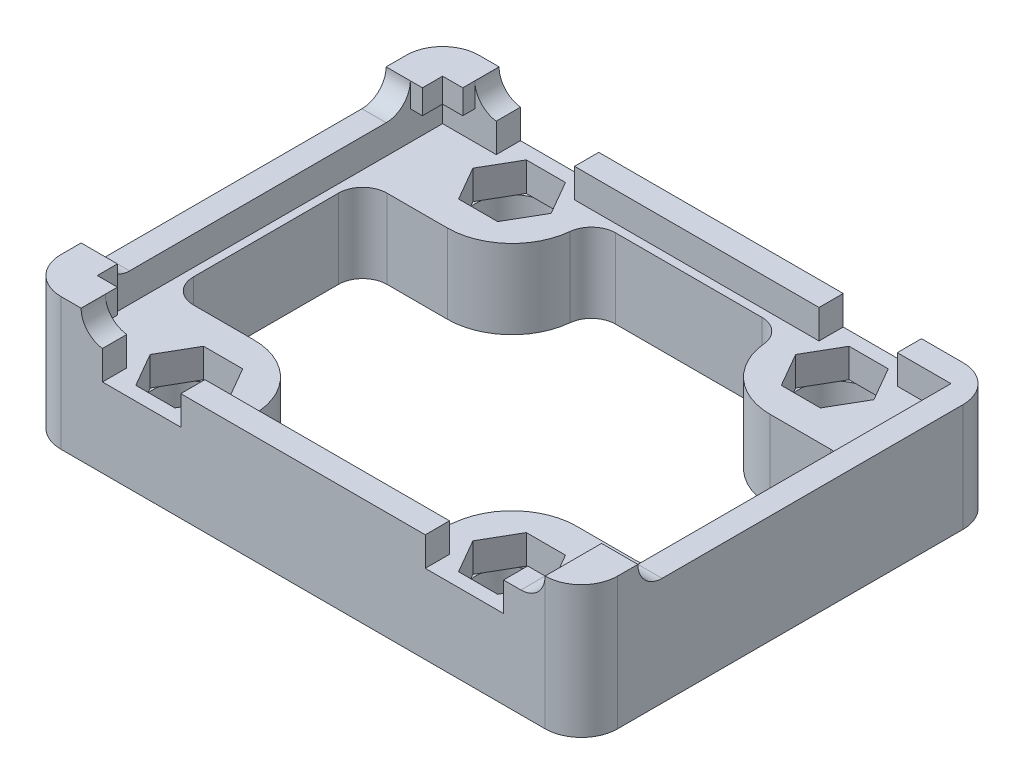
from build123d import *

# Parameters (mm, degrees)
SKETCH1_W           = 34.5
SKETCH1_H           = 25.9
SKETCH1_R           = 1.55
BOSS_EXTRUDE1_DEPTH = 1.5
SKETCH3_W           = 34.5
SKETCH3_H           = 25.9
SKETCH3_R           = 2.25
BOSS_EXTRUDE3_DEPTH = 1.6
SKETCH5_W           = 34.5
SKETCH5_H           = 25.9
BOSS_EXTRUDE4_DEPTH = 1.8
SKETCH6_W           = 15.150257738
SKETCH6_H           = 1.5
BOSS_EXTRUDE5_DEPTH = 1.8
BOSS_EXTRUDE6_DEPTH = 1.5
CUT_EXTRUDE1_REACH  = 24.165
FILLET1_R           = 1.5
FILLET2_R           = 2.25


with BuildPart() as part:
    # Sketch1 → Boss-Extrude1 (new body)
    with BuildSketch(Plane(origin=(0, 0, 0), x_dir=(1, 0, 0), z_dir=(0, 1, 0))):
        Rectangle(SKETCH1_W, SKETCH1_H)
        with Locations(Location((-10, 10, 0), (0, 0, 270))):
            Circle(SKETCH1_R, mode=Mode.SUBTRACT)
        with Locations(Location((10, 10, 0), (0, 0, 270))):
            Circle(SKETCH1_R, mode=Mode.SUBTRACT)
        with Locations(Location((10, -10, 0), (0, 0, 270))):
            Circle(SKETCH1_R, mode=Mode.SUBTRACT)
        with Locations(Location((-10, -10, 0), (0, 0, 270))):
            Circle(SKETCH1_R, mode=Mode.SUBTRACT)
    extrude(amount=BOSS_EXTRUDE1_DEPTH)

    # Sketch3 → Boss-Extrude3 (add)
    with BuildSketch(Plane(origin=(0, 1.5, 0), x_dir=(1, 0, 0), z_dir=(0, 1, 0))):
        Rectangle(SKETCH3_W, SKETCH3_H)
        with Locations(Location((-10, 10, 0), (0, 0, 270))):
            Circle(SKETCH3_R, mode=Mode.SUBTRACT)
        with Locations(Location((10, 10, 0), (0, 0, 270))):
            Circle(SKETCH3_R, mode=Mode.SUBTRACT)
        with Locations(Location((10, -10, 0), (0, 0, 270))):
            Circle(SKETCH3_R, mode=Mode.SUBTRACT)
        with Locations(Location((-10, -10, 0), (0, 0, 270))):
            Circle(SKETCH3_R, mode=Mode.SUBTRACT)
    extrude(amount=BOSS_EXTRUDE3_DEPTH)

    # Sketch5 → Boss-Extrude4 (add)
    with BuildSketch(Plane(origin=(0, 3.1, 0), x_dir=(1, 0, 0), z_dir=(0, 1, 0))):
        Rectangle(SKETCH5_W, SKETCH5_H)
        with BuildLine():
            Line((-6, -10.95), (-6, -10))
            ThreePointArc((-6, -10), (-7.171572875, -7.171572875), (-10, -6))
            Line((-10, -6), (-15.25, -6))
            Line((-15.25, -6), (-15.25, 6))
            Line((-15.25, 6), (-10, 6))
            ThreePointArc((-10, 6), (-7.171572875, 7.171572875), (-6, 10))
            Line((-6, 10), (-6, 10.95))
            Line((-6, 10.95), (6, 10.95))
            Line((6, 10.95), (6, 10))
            ThreePointArc((6, 10), (7.171572875, 7.171572875), (10, 6))
            Line((10, 6), (15.25, 6))
            Line((15.25, 6), (15.25, -6))
            Line((15.25, -6), (10, -6))
            ThreePointArc((10, -6), (7.171572875, -7.171572875), (6, -10))
            Line((6, -10), (6, -10.95))
            Line((6, -10.95), (-6, -10.95))
        make_face(mode=Mode.SUBTRACT)
        Polygon((12.424871131, 10), (11.212435565, 7.9), (8.787564435, 7.9), (7.575128869, 10), (8.787564435, 12.1), (11.212435565, 12.1), align=None, mode=Mode.SUBTRACT)
        Polygon((-7.575128869, 10), (-8.787564435, 7.9), (-11.212435565, 7.9), (-12.424871131, 10), (-11.212435565, 12.1), (-8.787564435, 12.1), align=None, mode=Mode.SUBTRACT)
        Polygon((7.575128869, -10), (8.787564435, -7.9), (11.212435565, -7.9), (12.424871131, -10), (11.212435565, -12.1), (8.787564435, -12.1), align=None, mode=Mode.SUBTRACT)
        Polygon((-8.787564435, -12.1), (-11.212435565, -12.1), (-12.424871131, -10), (-11.212435565, -7.9), (-8.787564435, -7.9), (-7.575128869, -10), align=None, mode=Mode.SUBTRACT)
    extrude(amount=BOSS_EXTRUDE4_DEPTH)

    # Sketch6 → Boss-Extrude5 (add)
    with BuildSketch(Plane(origin=(0, 4.9, 0), x_dir=(1, 0, 0), z_dir=(0, 1, 0))):
        Polygon((-12.424871131, -11.45), (-15.75, -11.45), (-15.75, 11.45), (-12.424871131, 11.45), (-12.424871131, 12.95), (-17.25, 12.95), (-17.25, -12.95), (-12.424871131, -12.95), align=None)
        with Locations((0, 12.2)):
            Rectangle(SKETCH6_W, SKETCH6_H)
        Polygon((15.75, -11.45), (12.424871131, -11.45), (12.424871131, -12.95), (17.25, -12.95), (17.25, 12.95), (12.424871131, 12.95), (12.424871131, 11.45), (15.75, 11.45), align=None)
        with Locations((0, -12.2)):
            Rectangle(SKETCH6_W, SKETCH6_H)
    extrude(amount=BOSS_EXTRUDE5_DEPTH)

    # Sketch7 → Boss-Extrude6 (add)
    with BuildSketch(Plane(origin=(0, 6.7, 0), x_dir=(1, 0, 0), z_dir=(0, 1, 0))):
        Polygon((-13.75, 12.95), (-17.25, 12.95), (-17.25, 9.45), (-15.75, 9.45), (-15.75, 11.45), (-13.75, 11.45), align=None)
        Polygon((-13.75, 10.7), (-13.75, 11.45), (-15.75, 11.45), (-15.75, 9.45), (-15, 9.45), (-15, 10.7), align=None)
        Polygon((-15.75, -9.45), (-17.25, -9.45), (-17.25, -12.95), (-13.75, -12.95), (-13.75, -11.45), (-15.75, -11.45), align=None)
        Polygon((-15, -9.45), (-15.75, -9.45), (-15.75, -11.45), (-13.75, -11.45), (-13.75, -10.7), (-15, -10.7), align=None)
        Polygon((17.25, -12.95), (17.25, -9.45), (15, -9.45), (15, -10.7), (15, -12.95), align=None)
    extrude(amount=BOSS_EXTRUDE6_DEPTH)

    # Sketch8 → Cut-Extrude1 (cut, up to next)
    with BuildSketch(Plane(origin=(0, 3.1, 0), x_dir=(1, 0, 0), z_dir=(0, 1, 0)), mode=Mode.PRIVATE) as cut_extrude1_sk1:
        with BuildLine():
            Line((10, -6), (15.25, -6))
            Line((15.25, -6), (15.25, 6))
            Line((15.25, 6), (10, 6))
            ThreePointArc((10, 6), (7.171572875, 7.171572875), (6, 10))
            Line((6, 10), (6, 10.95))
            Line((6, 10.95), (-6, 10.95))
            Line((-6, 10.95), (-6, 10))
            ThreePointArc((-6, 10), (-7.171572875, 7.171572875), (-10, 6))
            Line((-10, 6), (-15.25, 6))
            Line((-15.25, 6), (-15.25, -6))
            Line((-15.25, -6), (-10, -6))
            ThreePointArc((-10, -6), (-7.171572875, -7.171572875), (-6, -10))
            Line((-6, -10), (-6, -10.95))
            Line((-6, -10.95), (6, -10.95))
            Line((6, -10.95), (6, -10))
            ThreePointArc((6, -10), (7.171572875, -7.171572875), (10, -6))
        make_face()
    cut_extrude1_tool1 = extrude(cut_extrude1_sk1.sketch, amount=-CUT_EXTRUDE1_REACH, mode=Mode.PRIVATE) & part.part
    add(cut_extrude1_tool1.solids().sort_by_distance((0, 3.1, 0))[0], mode=Mode.SUBTRACT)

    # Fillet1
    # the kernel refuses this fillet: 1.5 mm, written as the material it adds along each edge
    with BuildSketch(Plane(origin=(6, 4.9, 10.95), x_dir=(-1, 0, 0), z_dir=(0, -1, 0))) as fillet1_piece_1:
        with BuildLine():
            CenterArc((1.472430904, 1.5), FILLET1_R, 185.739170477, 84.260829523)
            Line((-0.020050252, 1.35), (-0.169298367, 1.335))
            ThreePointArc((-0.169298367, 1.335), (-0.15, 0.95), (-0.15, 0))
            Line((-0.15, 0), (0, -0.15))
            Line((0, -0.15), (1.472430904, -0.15))
            Line((1.472430904, -0.15), (1.472430904, 0))
        make_face()
    extrude(amount=4.9)
    with BuildSketch(Plane(origin=(15.25, 4.9, 6), x_dir=(-1, 0, 0), z_dir=(0, -1, 0)), Plane(origin=(15.25, 4.9, -6), x_dir=(0, 0, 1), z_dir=(0, -1, 0))) as fillet1_piece_2:
        with BuildLine():
            CenterArc((FILLET1_R, FILLET1_R), FILLET1_R, 180, 90)
            Line((0, FILLET1_R), (0, 0))
            Line((0, 0), (FILLET1_R, 0))
        make_face()
    extrude(amount=4.9)
    with BuildSketch(Plane(origin=(6, 4.9, -10.95), x_dir=(0.014850400419695863, 0, 0.9998897267235897), z_dir=(0, -1, 0))) as fillet1_piece_3:
        with BuildLine():
            CenterArc((1.477968402, 1.494544135), FILLET1_R, 180.850896545, 84.260829523)
            Line((-0.021866189, 1.472268534), (-0.171849648, 1.470040974))
            Line((-0.171849648, 1.470040974), (-0.149983459, -0.00222756))
            Line((-0.149983459, -0.00222756), (0.00222756, -0.149983459))
            ThreePointArc((0.00222756, -0.149983459), (0.9521228, -0.135875579), (1.337366934, -0.149454413))
            Line((1.337366934, -0.149454413), (1.350148885, 0))
        make_face()
    extrude(amount=4.9)
    with BuildSketch(Plane(origin=(-6, 0, -10.95), x_dir=(1, 0, 0), z_dir=(0, 1, 0))) as fillet1_piece_4:
        with BuildLine():
            CenterArc((1.472430904, -1.5), FILLET1_R, 90, 84.260829523)
            Line((-0.020050252, -1.35), (-0.169298367, -1.335))
            ThreePointArc((-0.169298367, -1.335), (-0.15, -0.95), (-0.15, 0))
            Line((-0.15, 0), (0, 0.15))
            Line((0, 0.15), (1.472430904, 0.15))
            Line((1.472430904, 0.15), (1.472430904, 0))
        make_face()
    extrude(amount=4.9)
    with BuildSketch(Plane(origin=(-15.25, 0, -6), x_dir=(1, 0, 0), z_dir=(0, 1, 0)), Plane(origin=(-15.25, 0, 6), x_dir=(0, 0, -1), z_dir=(0, 1, 0))) as fillet1_piece_5:
        with BuildLine():
            CenterArc((FILLET1_R, -FILLET1_R), FILLET1_R, 90, 90)
            Line((0, -FILLET1_R), (0, 0))
            Line((0, 0), (FILLET1_R, 0))
        make_face()
    extrude(amount=4.9)
    with BuildSketch(Plane(origin=(-6, 0, 10.95), x_dir=(-0.014850400419695205, 0, -0.9998897267235897), z_dir=(0, 1, 0))) as fillet1_piece_6:
        with BuildLine():
            CenterArc((1.477968402, -1.494544135), FILLET1_R, 94.888273932, 84.260829523)
            Line((-0.021866189, -1.472268534), (-0.171849648, -1.470040974))
            Line((-0.171849648, -1.470040974), (-0.149983459, 0.00222756))
            Line((-0.149983459, 0.00222756), (0.00222756, 0.149983459))
            ThreePointArc((0.00222756, 0.149983459), (0.9521228, 0.135875579), (1.337366934, 0.149454413))
            Line((1.337366934, 0.149454413), (1.350148885, 0))
        make_face()
    extrude(amount=4.9)
    with BuildSketch(Plane(origin=(17.25, 6.7, 9.45), x_dir=(0, 0, -1), z_dir=(-1, 0, 0)), Plane(origin=(15, 6.7, 11.45), x_dir=(-1, 0, 0), z_dir=(0, 0, 1)), Plane(origin=(-15.75, 6.7, 9.45), x_dir=(0, 0, -1), z_dir=(-1, 0, 0)), Plane(origin=(-15.75, 6.7, -9.45), x_dir=(0, 1, 0), z_dir=(-1, 0, 0))) as fillet1_piece_7:
        with BuildLine():
            CenterArc((FILLET1_R, -FILLET1_R), FILLET1_R, 90, 90)
            Line((0, -FILLET1_R), (0, 0))
            Line((0, 0), (FILLET1_R, 0))
        make_face()
    extrude(amount=1.5)
    with BuildSketch(Plane(origin=(-13.75, 6.7, -11.45), x_dir=(1, 0, 0), z_dir=(0, 0, -1))) as fillet1_piece_8:
        with BuildLine():
            CenterArc((1.5, -1.489771824), FILLET1_R, 96.694808908, 83.305191092)
            Line((0, -1.489771824), (0, 0))
            Line((0, 0), (1.325128869, 0))
        make_face()
    extrude(amount=1.5)
    with BuildSketch(Plane(origin=(-13.75, 6.7, 11.45), x_dir=(0, 1, 0), z_dir=(0, 0, 1))) as fillet1_piece_9:
        with BuildLine():
            CenterArc((1.489771824, -1.5), FILLET1_R, 90, 83.305191092)
            Line((0, -1.325128869), (0, 0))
            Line((0, 0), (1.489771824, 0))
        make_face()
    extrude(amount=1.5)

    # Fillet2
    fillet2_edges = [part.edges().sort_by_distance(p)[0] for p in [
        (17.25, 4.1, 12.95),
        (-17.25, 4.1, 12.95),
        (-17.25, 4.1, -12.95),
        (17.25, 3.35, -12.95),
    ]]
    fillet(fillet2_edges, radius=FILLET2_R)


solid = part.part
